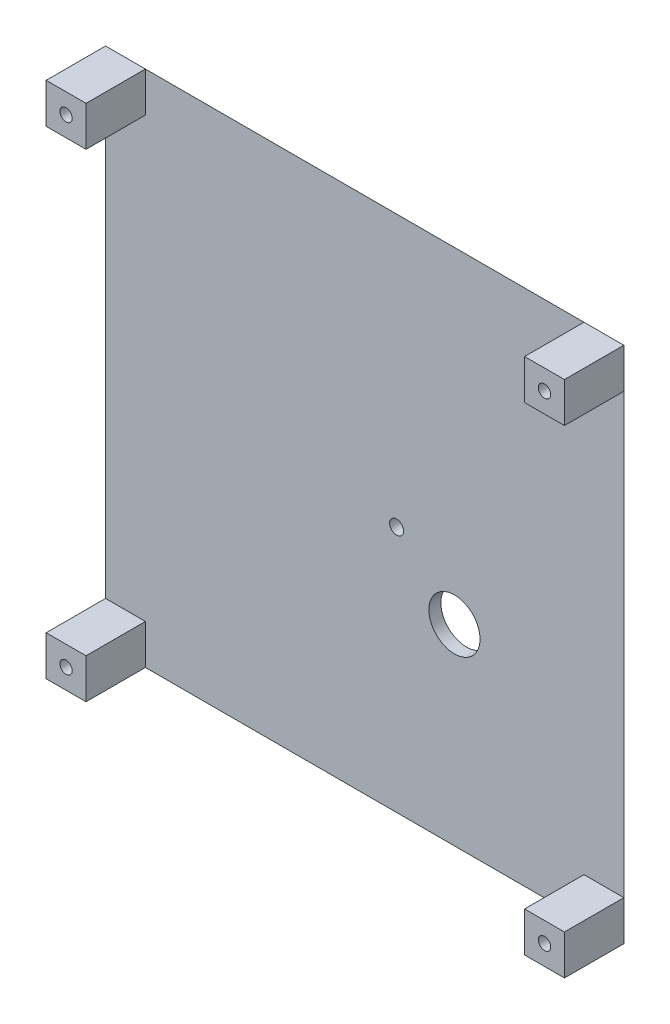
from build123d import *

# Parameters (mm, degrees)
ESQUISSE1_W             = 130
ESQUISSE1_H             = 130
BOSS_EXTRU_1_DEPTH      = 3
CHANFREIN1_SIZE         = 3
ESQUISSE2_W             = 10
ESQUISSE2_H             = 10
ESQUISSE2_R             = 1.55
BOSS_EXTRU_2_DEPTH      = 14.9
ESQUISSE3_R             = 6.415348162
ESQUISSE3_R_2           = 1.75
ENL_V_MAT_EXTRU_1_DEPTH = 14.9


with BuildPart() as part:
    # Esquisse1 → Boss.-Extru.1 (new body)
    with BuildSketch(Plane.XY):
        with Locations((65, 65)):
            Rectangle(ESQUISSE1_W, ESQUISSE1_H)
    extrude(amount=BOSS_EXTRU_1_DEPTH)

    # Chanfrein1
    chanfrein1_edges = [part.edges().sort_by_distance(p)[0] for p in [
        (65, 130, 0),
        (130, 65, 0),
        (65, 0, 0),
        (0, 65, 0),
    ]]
    chamfer(chanfrein1_edges, length=CHANFREIN1_SIZE - 0.0001)  # a hair under: the kernel refuses the full size

    # Esquisse2 → Boss.-Extru.2 (add)
    # profile 1 of 4: a face of its own
    with BuildSketch(Plane.XY.offset(3)):
        with Locations((5, 125)):
            Rectangle(ESQUISSE2_W, ESQUISSE2_H)
        with Locations((5, 125)):
            Circle(ESQUISSE2_R, mode=Mode.SUBTRACT)
    # profile 2 of 4: a face of its own
    with BuildSketch(Plane.XY.offset(3)):
        with Locations((125, 125)):
            Rectangle(ESQUISSE2_W, ESQUISSE2_H)
        with Locations((125, 125)):
            Circle(ESQUISSE2_R, mode=Mode.SUBTRACT)
    # profile 3 of 4: a face of its own
    with BuildSketch(Plane.XY.offset(3)):
        with Locations((125, 5)):
            Rectangle(ESQUISSE2_W, ESQUISSE2_H)
        with Locations((125, 5)):
            Circle(ESQUISSE2_R, mode=Mode.SUBTRACT)
    # profile 4 of 4: a face of its own
    with BuildSketch(Plane.XY.offset(3)):
        with Locations((5, 5)):
            Rectangle(ESQUISSE2_W, ESQUISSE2_H)
        with Locations((5, 5)):
            Circle(ESQUISSE2_R, mode=Mode.SUBTRACT)
    extrude(amount=BOSS_EXTRU_2_DEPTH)

    # Esquisse3 → Enlèv. mat.-Extru.1 (cut)
    with BuildSketch(Plane.XY.offset(3)):
        with Locations((87.513655995, 48.114761129)):
            Circle(ESQUISSE3_R)
        with Locations((73, 62)):
            Circle(ESQUISSE3_R_2)
    extrude(amount=-ENL_V_MAT_EXTRU_1_DEPTH, mode=Mode.SUBTRACT)


solid = part.part
